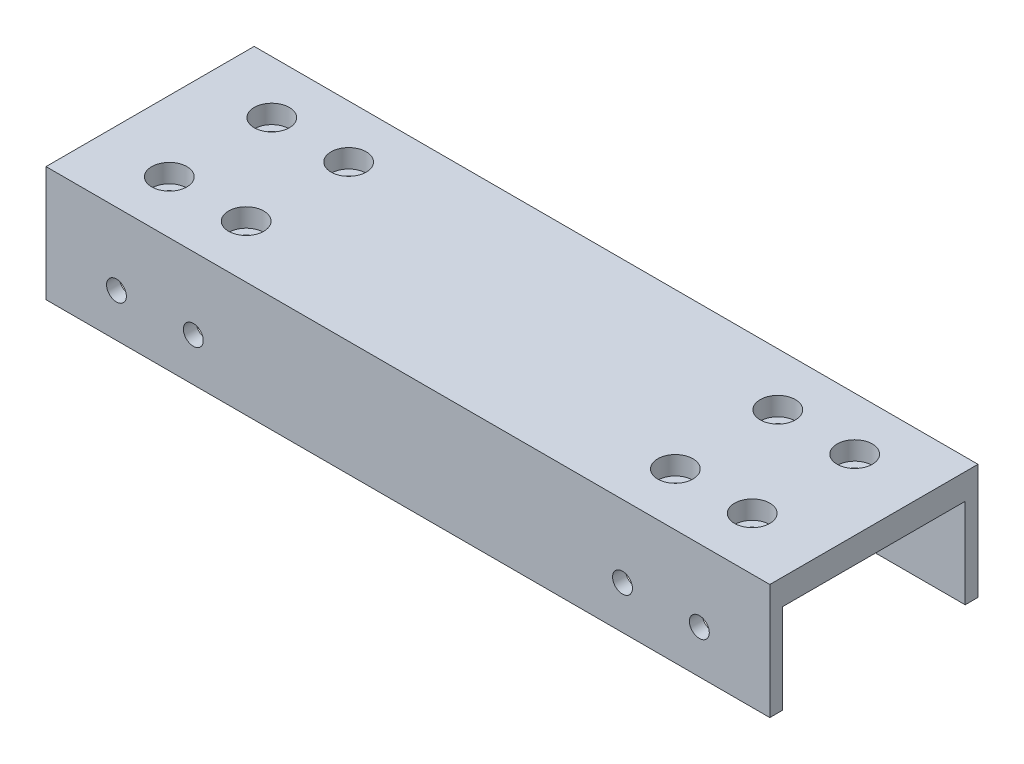
from build123d import *

# Parameters (mm, degrees)
SKETCH1_W                                            = 113
SKETCH1_H                                            = 32.5
BOSS_EXTRUDE1_DEPTH                                  = 4
CBORE_FOR_M2_5_HEX_SOCKET_HEAD_CAP_SCREW_D           = 2.9
CBORE_FOR_M2_5_HEX_SOCKET_HEAD_CAP_SCREW_CBORE_D     = 5.5
CBORE_FOR_M2_5_HEX_SOCKET_HEAD_CAP_SCREW_CBORE_DEPTH = 2.9
SKETCH5_W                                            = 113
SKETCH5_H                                            = 2
BOSS_EXTRUDE2_DEPTH                                  = 14
BOSS_EXTRUDE3_REACH                                  = 120.951
SKETCH7_W                                            = 44
SKETCH7_H                                            = 28.5
M2_5_CLEARANCE_HOLE1_D                               = 3.1


with BuildPart() as part:
    # Sketch1 → Boss-Extrude1 (new body)
    with BuildSketch(Plane(origin=(0, 0, 0), x_dir=(1, 0, 0), z_dir=(0, 1, 0))):
        with Locations((56.5, 16.25)):
            Rectangle(SKETCH1_W, SKETCH1_H)
    extrude(amount=BOSS_EXTRUDE1_DEPTH)

    # CBORE for M2.5 Hex Socket Head Cap Screw1 (through all)
    with Locations(Plane(origin=(0, 4, 0), x_dir=(1, 0, 0), z_dir=(0, 1, 0))):
        with Locations((11, 24.25), (23, 24.25), (23, 8.25), (11, 8.25), (102, 8.25), (90, 8.25), (90, 24.25), (102, 24.25)):
            CounterBoreHole(CBORE_FOR_M2_5_HEX_SOCKET_HEAD_CAP_SCREW_D / 2, CBORE_FOR_M2_5_HEX_SOCKET_HEAD_CAP_SCREW_CBORE_D / 2, CBORE_FOR_M2_5_HEX_SOCKET_HEAD_CAP_SCREW_CBORE_DEPTH)

    # Sketch5 → Boss-Extrude2 (add)
    with BuildSketch(Plane.XZ):
        with Locations((56.5, -1)):
            Rectangle(SKETCH5_W, SKETCH5_H)
        with Locations((56.5, -31.5)):
            Rectangle(SKETCH5_W, SKETCH5_H)
    extrude(amount=BOSS_EXTRUDE2_DEPTH)

    # Sketch7 → Boss-Extrude3 (add, up to next)
    with BuildSketch(Plane.XZ.offset(14), mode=Mode.PRIVATE) as boss_extrude3_sk1:
        with Locations((56.5, -16.25)):
            Rectangle(SKETCH7_W, SKETCH7_H)
    boss_extrude3_tool1 = extrude(boss_extrude3_sk1.sketch, amount=-BOSS_EXTRUDE3_REACH, mode=Mode.PRIVATE) - part.part
    add(boss_extrude3_tool1.solids().sort_by_distance((56.5, -14, -16.25))[0])

    # M2.5 Clearance Hole1 (through all)
    with Locations(Plane(origin=(0, 0, -32.5), x_dir=(-1, 0, 0), z_dir=(0, 0, -1))):
        with Locations((-11, -7.25), (-23, -7.25), (-102, -7.25), (-90, -7.25)):
            Hole(M2_5_CLEARANCE_HOLE1_D / 2)


solid = part.part
